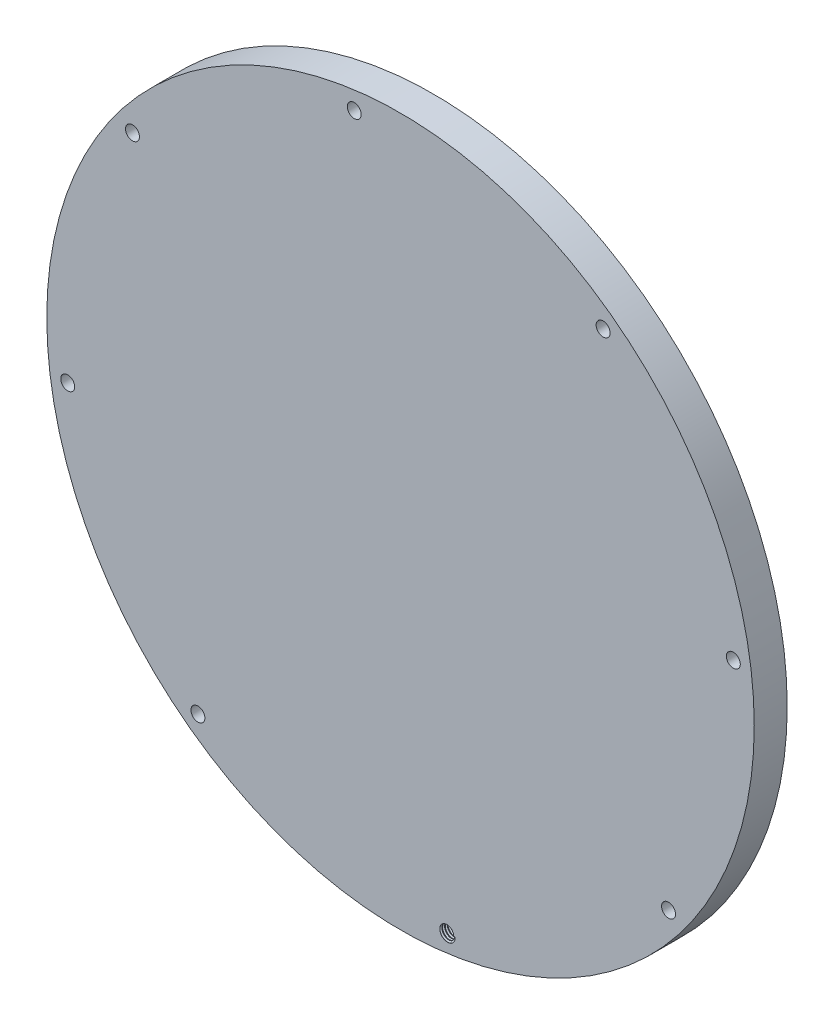
from build123d import *
from build123d.topology import SkipClean

# Parameters (mm, degrees)
ESQUISSE1_R      = 139.5
DISQUE_DEPTH     = 13
ESQUISSE2_R      = 2.75
PAS_DE_VIS_DEPTH = 13
ESQUISSE4_R      = 120
BAIN_DEPTH       = 3
FILETAGE1_PITCH  = 1.058333333
MILIEU1_DEPTH    = 3
EST1_DEPTH       = 3
OUEST1_DEPTH     = 3
SUD_DEPTH        = 3
NORD_DEPTH       = 3


with BuildPart() as part:
    # Esquisse1 → Disque (new body)
    with BuildSketch(Plane.XY):
        with Locations(Location((0, 0, 0), (0, 0, 180))):
            Circle(ESQUISSE1_R)
    extrude(amount=DISQUE_DEPTH)

    # Esquisse2 → Pas_De_Vis (cut)
    with BuildSketch(Plane(origin=(0, 0, 0), x_dir=(-1, 0, 0), z_dir=(0, 0, -1))):
        with Locations((-79.895152306, 105.702481702)):
            Circle(ESQUISSE2_R)
        with Locations((18.24853762, 131.237345579)):
            Circle(ESQUISSE2_R)
        with Locations((105.702481702, 79.895152306)):
            Circle(ESQUISSE2_R)
        with Locations((131.237345579, -18.24853762)):
            Circle(ESQUISSE2_R)
        with Locations((79.895152306, -105.702481702)):
            Circle(ESQUISSE2_R)
        with Locations((-18.24853762, -131.237345579)):
            Circle(ESQUISSE2_R)
        with Locations((-105.702481702, -79.895152306)):
            Circle(ESQUISSE2_R)
        with Locations((-131.237345579, 18.24853762)):
            Circle(ESQUISSE2_R)
    extrude(amount=-PAS_DE_VIS_DEPTH, mode=Mode.SUBTRACT)

    # Esquisse4 → Bain (cut)
    with BuildSketch(Plane(origin=(0, 0, 0), x_dir=(-1, 0, 0), z_dir=(0, 0, -1))):
        Circle(ESQUISSE4_R)
    extrude(amount=-BAIN_DEPTH, mode=Mode.SUBTRACT)

    # Filetage1: the profile of Profil de filetage1 profile screwed along a right-hand helix of 12 turns, 8 arcs to a turn; built about Z, then put on its axis
    with SkipClean():  # the faces are left unmerged after this step: merging them gives an invalid solid
        filetage1_z = Axis((0, 0, 0), (0, 0, 1))
        filetage1_corners = [(2.7497, 0, -0.000173205), (3.322839718, 0, 0.330729165), (3.322839718, 0, 0.463020832), (2.7497, 0, 0.793923202)]
        with BuildLine(mode=Mode.PRIVATE) as filetage1_profile:
            Line(filetage1_corners[0], filetage1_corners[1])
            Line(filetage1_corners[1], filetage1_corners[2])
            Line(filetage1_corners[2], filetage1_corners[3])
            Line(filetage1_corners[3], filetage1_corners[0])
        filetage1_cap = Face(filetage1_profile.wire())
        filetage1_turn_angles = [0, 22.5, 45, 67.5, 90, 112.5, 135, 157.5, 180, 202.5, 225, 247.5, 270, 292.5, 315, 337.5, 360]
        filetage1_turn_weights = [1, 0.9238795325112867, 1, 0.9238795325112867, 1, 0.9238795325112867, 1, 0.9238795325112867, 1, 0.9238795325112867, 1, 0.9238795325112867, 1, 0.9238795325112867, 1, 0.9238795325112867, 1]
        filetage1_turn_rails = [Edge.make_bspline([Vector(p[0], p[1], 0).rotate(filetage1_z, filetage1_turn_angles[k]) / filetage1_turn_weights[k] + Vector(0, 0, p[2] + FILETAGE1_PITCH * filetage1_turn_angles[k] / 360) for k in range(17)], [0, 0, 0, 1, 1, 2, 2, 3, 3, 4, 4, 5, 5, 6, 6, 7, 7, 8, 8, 8], 2, filetage1_turn_weights) for p in filetage1_corners]
        filetage1_turn_sides = [Face.make_surface_from_curves(filetage1_turn_rails[p[0]], filetage1_turn_rails[p[1]]) for p in [(0, 1), (1, 2), (2, 3), (3, 0)]]
        filetage1 = Plane(origin=(18.24853762, -131.237345579, 0), x_dir=(1, 0, 0), z_dir=(0, 0, 1)) * Solid(Shell([*[p.moved(Location((0, 0, FILETAGE1_PITCH * i))) for i in range(12) for p in filetage1_turn_sides], filetage1_cap, filetage1_cap.rotate(filetage1_z, 4320).moved(Location((0, 0, FILETAGE1_PITCH * 4320 / 360)))]))
        add(filetage1, mode=Mode.SUBTRACT)

    # Milieu → Milieu1 (cut)
    with SkipClean():  # the faces are left unmerged after this step: merging them gives an invalid solid
        with BuildSketch(Plane(origin=(0, 0, 3), x_dir=(-1, 0, 0), z_dir=(0, 0, -1))):
            with BuildLine():
                Line((28.5, -28.5), (28.5, 28.5))
                ThreePointArc((28.5, 28.5), (0, 57), (-28.5, 28.5))
                Line((-28.5, 28.5), (-28.5, -28.5))
                ThreePointArc((-28.5, -28.5), (0, -57), (28.5, -28.5))
            make_face()
        extrude(amount=-MILIEU1_DEPTH, mode=Mode.SUBTRACT)

    # Est → Est1 (cut)
    with SkipClean():  # the faces are left unmerged after this step: merging them gives an invalid solid
        with BuildSketch(Plane(origin=(0, 0, 3), x_dir=(-1, 0, 0), z_dir=(0, 0, -1))):
            with BuildLine():
                Line((-53.5, -18.203526102), (-53.5, 19.796473898))
                ThreePointArc((-53.5, 19.796473898), (-72.860459785, 37.996256197), (-91.483251529, 19.042335587))
                Line((-91.483251529, 19.042335587), (-91.483251529, -18.957664413))
                ThreePointArc((-91.483251529, -18.957664413), (-72.106137604, -37.996256197), (-53.5, -18.203526102))
            make_face()
        extrude(amount=-EST1_DEPTH, mode=Mode.SUBTRACT)

    # Ouest → Ouest1 (cut)
    with SkipClean():  # the faces are left unmerged after this step: merging them gives an invalid solid
        with BuildSketch(Plane(origin=(0, 0, 3), x_dir=(-1, 0, 0), z_dir=(0, 0, -1))):
            with BuildLine():
                Line((60, 14.25), (60, -14.25))
                ThreePointArc((60, -14.25), (74.25, -28.5), (88.5, -14.25))
                Line((88.5, -14.25), (88.5, 14.25))
                ThreePointArc((88.5, 14.25), (74.25, 28.5), (60, 14.25))
            make_face()
        extrude(amount=-OUEST1_DEPTH, mode=Mode.SUBTRACT)

    # Esquisse12 → Sud (cut)
    with SkipClean():  # the faces are left unmerged after this step: merging them gives an invalid solid
        with BuildSketch(Plane(origin=(0, 0, 3), x_dir=(-1, 0, 0), z_dir=(0, 0, -1))):
            with BuildLine():
                Line((-9.5, 94.5), (9.5, 94.5))
                ThreePointArc((9.5, 94.5), (19, 85), (9.5, 75.5))
                Line((9.5, 75.5), (-9.5, 75.5))
                ThreePointArc((-9.5, 75.5), (-19, 85), (-9.5, 94.5))
            make_face()
        extrude(amount=-SUD_DEPTH, mode=Mode.SUBTRACT)

    # Esquisse14 → Nord (cut)
    with SkipClean():  # the faces are left unmerged after this step: merging them gives an invalid solid
        with BuildSketch(Plane(origin=(0, 0, 3), x_dir=(-1, 0, 0), z_dir=(0, 0, -1))):
            with BuildLine():
                Line((-7.125, -81.375), (7.125, -81.375))
                ThreePointArc((7.125, -81.375), (14.25, -88.5), (7.125, -95.625))
                Line((7.125, -95.625), (-7.125, -95.625))
                ThreePointArc((-7.125, -95.625), (-14.25, -88.5), (-7.125, -81.375))
            make_face()
        extrude(amount=-NORD_DEPTH, mode=Mode.SUBTRACT)


solid = part.part
